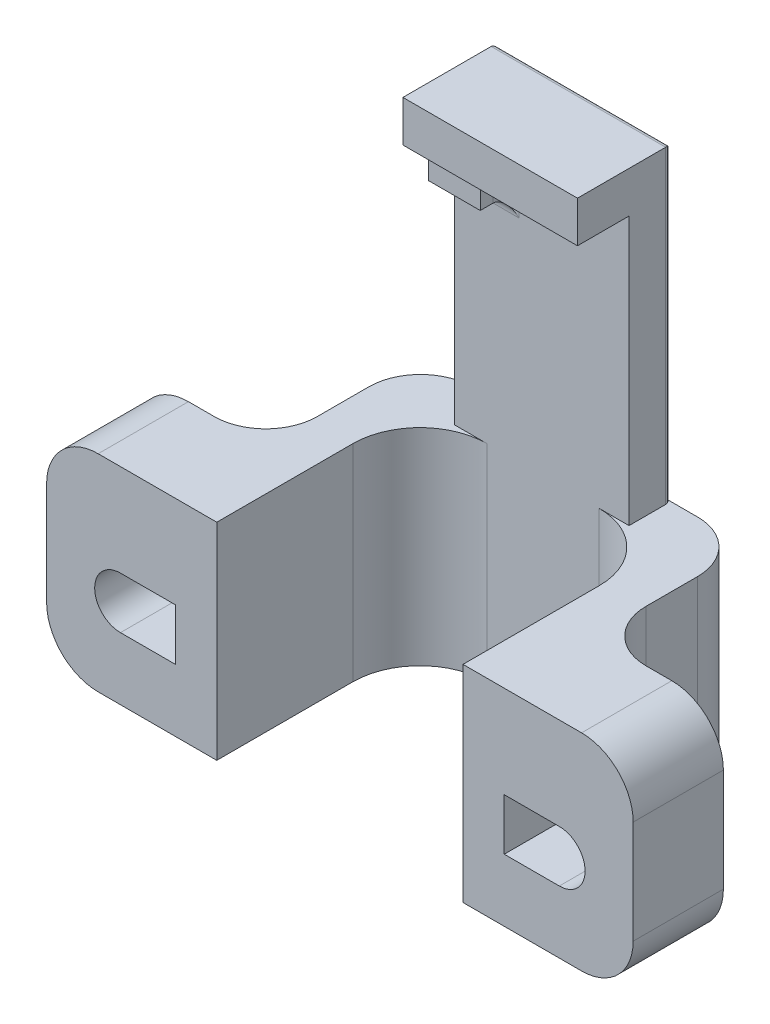
from build123d import *

# Parameters (mm, degrees)
BOSS_EXTRUDE1_DEPTH = 2.0574
SKETCH4_W           = 12.065
SKETCH4_H           = 10.16
BOSS_EXTRUDE2_DEPTH = 2.032
SKETCH5_W           = 12.065
SKETCH5_H           = 10.16
BOSS_EXTRUDE3_DEPTH = 2.032
SKETCH8_W           = 8.5979
SKETCH8_H           = 2.032
BOSS_EXTRUDE4_DEPTH = 2.54
FILLET22_R          = 3.302
CUT_EXTRUDE12_DEPTH = 13.208
SKETCH28_W          = 2.54
SKETCH28_H          = 1.27
BOSS_EXTRUDE6_DEPTH = 1.27
BOSS_EXTRUDE7_DEPTH = 4.445
FILLET23_R          = 0.635
CUT_EXTRUDE15_DEPTH = 1.651
FILLET25_R          = 0.254
FILLET26_R          = 2.54


with BuildPart() as part:
    # Sketch1 → Boss-Extrude1 (new body)
    with BuildSketch(Plane.XY):
        Polygon((0, 0), (12.1285, 0), (12.1285, 10.16), (10.2997, 10.16), (10.2997, 25.4), (1.7018, 25.4), (1.7018, 10.16), (0, 10.16), align=None)
    extrude(amount=BOSS_EXTRUDE1_DEPTH)

    # Sketch4 → Boss-Extrude2 (add)
    with BuildSketch(Plane(origin=(12.1285, 0, 0), x_dir=(0, 0, -1), z_dir=(1, 0, 0))):
        with Locations((-6.0325, 5.08)):
            Rectangle(SKETCH4_W, SKETCH4_H)
    extrude(amount=BOSS_EXTRUDE2_DEPTH)

    # Sketch5 → Boss-Extrude3 (add)
    with BuildSketch(Plane.ZY):
        with Locations((6.0325, 5.08)):
            Rectangle(SKETCH5_W, SKETCH5_H)
    extrude(amount=BOSS_EXTRUDE3_DEPTH)

    # Sketch8 → Boss-Extrude4 (add)
    with BuildSketch(Plane.XY.offset(2.0574)):
        with Locations((6.00075, 24.384)):
            Rectangle(SKETCH8_W, SKETCH8_H)
    extrude(amount=BOSS_EXTRUDE4_DEPTH)

    # Fillet22
    fillet22_edges = [part.edges().sort_by_distance(p)[0] for p in [
        (12.1285, 5.08, 2.0574),
        (0, 5.08, 2.0574),
    ]]
    fillet(fillet22_edges, radius=FILLET22_R)

    # Sketch26 → Cut-Extrude12 (cut)
    with BuildSketch(Plane.XZ.offset(-23.368)):
        Polygon((8.382, 4.5974), (1.7018, 4.5974), (1.620324679, 2.0574), (10.2997, 2.0574), (10.2997, 4.5974), align=None)
    extrude(amount=CUT_EXTRUDE12_DEPTH, mode=Mode.SUBTRACT)

    # Sketch28 → Boss-Extrude6 (add)
    with BuildSketch(Plane.XY.offset(2.0574)):
        with Locations((2.9718, 21.844)):
            Rectangle(SKETCH28_W, SKETCH28_H)
    extrude(amount=BOSS_EXTRUDE6_DEPTH)

    # Sketch30 → Boss-Extrude7 (add)
    with BuildSketch(Plane(origin=(0, 0, 12.065), x_dir=(-1, 0, 0), z_dir=(0, 0, -1))):
        with BuildLine():
            Line((2.032, 3.076559617), (2.032, 0))
            Line((2.032, 0), (5.842, 0))
            ThreePointArc((5.842, 0), (7.638051224, 0.743948776), (8.382, 2.54))
            Line((8.382, 2.54), (8.382, 7.62))
            ThreePointArc((8.382, 7.62), (7.638051224, 9.416051224), (5.842, 10.16))
            Line((5.842, 10.16), (2.032, 10.16))
            Line((2.032, 10.16), (2.032, 5.616559617))
            Line((2.032, 5.616559617), (4.744929833, 5.616559617))
            ThreePointArc((4.744929833, 5.616559617), (6.014929833, 4.346559617), (4.744929833, 3.076559617))
            Line((4.744929833, 3.076559617), (2.032, 3.076559617))
        make_face()
    boss_extrude7 = extrude(amount=BOSS_EXTRUDE7_DEPTH)

    # Fillet23
    fillet23_edges = [part.edges().sort_by_distance(p)[0] for p in [
        (2.9718, 21.209, 2.0574),
        (4.2418, 21.844, 2.0574),
    ]]
    fillet(fillet23_edges, radius=FILLET23_R)

    # Sketch34 → Cut-Extrude15 (cut)
    with BuildSketch(Plane(origin=(0, 0, 7.62), x_dir=(-1, 0, 0), z_dir=(0, 0, -1))):
        Polygon((4.744929833, 7.077059617), (2.380247468, 5.711809617), (2.380247468, 2.981309617), (4.744929833, 1.616059617), (7.109612198, 2.981309617), (7.109612198, 5.711809617), align=None)
    cut_extrude15 = extrude(amount=-CUT_EXTRUDE15_DEPTH, mode=Mode.SUBTRACT)

    # Fillet25
    fillet25_edges = [part.edges().sort_by_distance(p)[0] for p in [
        (1.7018, 17.78, 0),
        (6.00075, 25.4, 0),
        (10.2997, 17.78, 0),
    ]]
    fillet(fillet25_edges, radius=FILLET25_R)

    # Mirror7: Boss-Extrude7, Cut-Extrude15 across plane
    add(boss_extrude7.mirror(Plane(origin=(6.06425, 0, 0), x_dir=(0, 0, 1), z_dir=(1, 0, 0))))
    add(cut_extrude15.mirror(Plane(origin=(6.06425, 0, 0), x_dir=(0, 0, 1), z_dir=(1, 0, 0))), mode=Mode.SUBTRACT)

    # Fillet26
    # the kernel refuses this fillet: 2.54 mm, written as the material it adds along each edge
    with BuildSketch(Plane(origin=(-2.032, 9.426559617, 7.62), x_dir=(-1, 0, 0), z_dir=(0, -1, 0))) as fillet26_piece_1_section:
        with BuildLine():
            CenterArc((FILLET26_R, FILLET26_R), FILLET26_R, 180, 90)
            Line((0, FILLET26_R), (0, 0))
            Line((0, 0), (FILLET26_R, 0))
        make_face()
    fillet26_piece_1 = extrude(amount=15.776559617, mode=Mode.PRIVATE)
    fillet26_piece_1 = split(fillet26_piece_1, bisect_by=Plane(origin=(-2.868298698, 5.616559617, 7.255726229), z_dir=(0, 1, 0)), keep=Keep.TOP, mode=Mode.PRIVATE)
    fillet26_piece_1 = split(fillet26_piece_1, bisect_by=Plane(origin=(-3.61155926, 6.422707812, 7.255726229), z_dir=(0.5000000000000006, 0.8660254037844384, 0)), keep=Keep.TOP, mode=Mode.PRIVATE)
    add(fillet26_piece_1)
    with BuildSketch(Plane(origin=(-2.032, 9.426559617, 7.62), x_dir=(-1, 0, 0), z_dir=(0, -1, 0))) as fillet26_piece_2_section:
        with BuildLine():
            CenterArc((FILLET26_R, FILLET26_R), FILLET26_R, 180, 90)
            Line((0, FILLET26_R), (0, 0))
            Line((0, 0), (FILLET26_R, 0))
        make_face()
    fillet26_piece_2 = extrude(amount=15.776559617, mode=Mode.PRIVATE)
    fillet26_piece_2 = split(fillet26_piece_2, bisect_by=Plane(origin=(-2.323081937, 5.616559617, 6.938732997), z_dir=(0, 1, 0)), keep=Keep.TOP, mode=Mode.PRIVATE)
    fillet26_piece_2 = split(fillet26_piece_2, bisect_by=Plane(origin=(-2.380247468, 5.647682341, 6.938732997), z_dir=(1, 0, 0)), keep=Keep.TOP, mode=Mode.PRIVATE)
    add(fillet26_piece_2)
    with BuildSketch(Plane(origin=(-2.032, 3.076559617, 7.62), x_dir=(-1, 0, 0), z_dir=(0, -1, 0))) as fillet26_piece_3_section:
        with BuildLine():
            CenterArc((FILLET26_R, FILLET26_R), FILLET26_R, 180, 90)
            Line((0, FILLET26_R), (0, 0))
            Line((0, 0), (FILLET26_R, 0))
        make_face()
    fillet26_piece_3 = extrude(amount=3.076559617, mode=Mode.PRIVATE)
    fillet26_piece_3 = split(fillet26_piece_3, bisect_by=Plane(origin=(-2.380247468, 3.045436894, 6.938732997), z_dir=(1, 0, 0)), keep=Keep.TOP, mode=Mode.PRIVATE)
    add(fillet26_piece_3)
    with BuildSketch(Plane(origin=(-2.032, 9.426559617, 7.62), x_dir=(-1, 0, 0), z_dir=(0, -1, 0))) as fillet26_piece_4_section:
        with BuildLine():
            CenterArc((FILLET26_R, FILLET26_R), FILLET26_R, 180, 90)
            Line((0, FILLET26_R), (0, 0))
            Line((0, 0), (FILLET26_R, 0))
        make_face()
    fillet26_piece_4 = extrude(amount=9.426559617, mode=Mode.PRIVATE)
    fillet26_piece_4 = split(fillet26_piece_4, bisect_by=Plane(origin=(-2.380247468, 1.352070174, 7.252623905), z_dir=(-1, 0, 0)), keep=Keep.TOP, mode=Mode.PRIVATE)
    fillet26_piece_4 = split(fillet26_piece_4, bisect_by=Plane(origin=(-3.445782292, 2.3661228, 7.252623905), z_dir=(0.5000000000000002, -0.8660254037844386, 0)), keep=Keep.TOP, mode=Mode.PRIVATE)
    add(fillet26_piece_4)
    with BuildSketch(Plane(origin=(-2.032, 10.16, 7.62), x_dir=(-1, 0, 0), z_dir=(0, -1, 0))) as fillet26_piece_5_section:
        with BuildLine():
            CenterArc((FILLET26_R, FILLET26_R), FILLET26_R, 180, 90)
            Line((0, FILLET26_R), (0, 0))
            Line((0, 0), (FILLET26_R, 0))
        make_face()
    fillet26_piece_5 = extrude(amount=4.543440383, mode=Mode.PRIVATE)
    fillet26_piece_5 = split(fillet26_piece_5, bisect_by=Plane(origin=(-3.774867909, 6.516994104, 7.257731874), z_dir=(0.5000000000000006, 0.8660254037844384, 0)), keep=Keep.TOP, mode=Mode.PRIVATE)
    add(fillet26_piece_5)
    with BuildSketch(Plane(origin=(-2.032, 16.51, 7.62), x_dir=(-1, 0, 0), z_dir=(0, -1, 0))) as fillet26_piece_6_section:
        with BuildLine():
            CenterArc((FILLET26_R, FILLET26_R), FILLET26_R, 180, 90)
            Line((0, FILLET26_R), (0, 0))
            Line((0, 0), (FILLET26_R, 0))
        make_face()
    fillet26_piece_6 = extrude(amount=10.893440383, mode=Mode.PRIVATE)
    fillet26_piece_6 = split(fillet26_piece_6, bisect_by=Plane(origin=(-2.380247468, 5.647682341, 6.938732997), z_dir=(1, 0, 0)), keep=Keep.TOP, mode=Mode.PRIVATE)
    fillet26_piece_6 = split(fillet26_piece_6, bisect_by=Plane(origin=(-2.309605395, 5.671024397, 6.938732997), z_dir=(-0.5000000000000006, -0.8660254037844384, 0)), keep=Keep.TOP, mode=Mode.PRIVATE)
    add(fillet26_piece_6)
    with BuildSketch(Plane(origin=(-2.032, 16.51, 7.62), x_dir=(-1, 0, 0), z_dir=(0, -1, 0))) as fillet26_piece_7_section:
        with BuildLine():
            CenterArc((FILLET26_R, FILLET26_R), FILLET26_R, 180, 90)
            Line((0, FILLET26_R), (0, 0))
            Line((0, 0), (FILLET26_R, 0))
        make_face()
    fillet26_piece_7 = extrude(amount=17.243440383, mode=Mode.PRIVATE)
    fillet26_piece_7 = split(fillet26_piece_7, bisect_by=Plane(origin=(-2.323081937, 0, 6.938732997), z_dir=(0, 1, 0)), keep=Keep.TOP, mode=Mode.PRIVATE)
    fillet26_piece_7 = split(fillet26_piece_7, bisect_by=Plane(origin=(-2.323081937, 3.076559617, 6.938732997), z_dir=(0, -1, 0)), keep=Keep.TOP, mode=Mode.PRIVATE)
    fillet26_piece_7 = split(fillet26_piece_7, bisect_by=Plane(origin=(-2.380247468, 3.045436894, 6.938732997), z_dir=(1, 0, 0)), keep=Keep.TOP, mode=Mode.PRIVATE)
    add(fillet26_piece_7)
    with BuildSketch(Plane(origin=(-2.032, 16.51, 7.62), x_dir=(-1, 0, 0), z_dir=(0, -1, 0))) as fillet26_piece_8_section:
        with BuildLine():
            CenterArc((FILLET26_R, FILLET26_R), FILLET26_R, 180, 90)
            Line((0, FILLET26_R), (0, 0))
            Line((0, 0), (FILLET26_R, 0))
        make_face()
    fillet26_piece_8 = extrude(amount=17.243440383, mode=Mode.PRIVATE)
    fillet26_piece_8 = split(fillet26_piece_8, bisect_by=Plane(origin=(-2.860318736, 0, 7.252623905), z_dir=(0, 1, 0)), keep=Keep.TOP, mode=Mode.PRIVATE)
    fillet26_piece_8 = split(fillet26_piece_8, bisect_by=Plane(origin=(-2.380247468, 1.352070174, 7.252623905), z_dir=(-1, 0, 0)), keep=Keep.TOP, mode=Mode.PRIVATE)
    fillet26_piece_8 = split(fillet26_piece_8, bisect_by=Plane(origin=(-3.445782292, 2.3661228, 7.252623905), z_dir=(0.5000000000000002, -0.8660254037844386, 0)), keep=Keep.TOP, mode=Mode.PRIVATE)
    add(fillet26_piece_8)
    with BuildSketch(Plane(origin=(14.1605, 9.426559617, 7.62), x_dir=(0, 0, -1), z_dir=(0, -1, 0))) as fillet26_piece_9_section:
        with BuildLine():
            CenterArc((FILLET26_R, FILLET26_R), FILLET26_R, 180, 90)
            Line((0, FILLET26_R), (0, 0))
            Line((0, 0), (FILLET26_R, 0))
        make_face()
    fillet26_piece_9 = extrude(amount=15.776559617, mode=Mode.PRIVATE)
    fillet26_piece_9 = split(fillet26_piece_9, bisect_by=Plane(origin=(14.316328874, 5.616559617, 6.756250479), z_dir=(0, 1, 0)), keep=Keep.TOP, mode=Mode.PRIVATE)
    fillet26_piece_9 = split(fillet26_piece_9, bisect_by=Plane(origin=(14.508747468, 7.530619089, 6.756250479), z_dir=(-1, 0, 0)), keep=Keep.TOP, mode=Mode.PRIVATE)
    add(fillet26_piece_9)
    with BuildSketch(Plane(origin=(14.1605, 9.426559617, 7.62), x_dir=(0, 0, -1), z_dir=(0, -1, 0))) as fillet26_piece_10_section:
        with BuildLine():
            CenterArc((FILLET26_R, FILLET26_R), FILLET26_R, 180, 90)
            Line((0, FILLET26_R), (0, 0))
            Line((0, 0), (FILLET26_R, 0))
        make_face()
    fillet26_piece_10 = extrude(amount=15.776559617, mode=Mode.PRIVATE)
    fillet26_piece_10 = split(fillet26_piece_10, bisect_by=Plane(origin=(14.508747468, 7.710072871, 7.255726229), z_dir=(1, 0, 0)), keep=Keep.TOP, mode=Mode.PRIVATE)
    fillet26_piece_10 = split(fillet26_piece_10, bisect_by=Plane(origin=(15.740059261, 6.422707812, 7.255726229), z_dir=(-0.5000000000000006, 0.8660254037844384, 0)), keep=Keep.TOP, mode=Mode.PRIVATE)
    add(fillet26_piece_10)
    with BuildSketch(Plane(origin=(14.1605, 3.076559617, 7.62), x_dir=(0, 0, -1), z_dir=(0, -1, 0))) as fillet26_piece_11_section:
        with BuildLine():
            CenterArc((FILLET26_R, FILLET26_R), FILLET26_R, 180, 90)
            Line((0, FILLET26_R), (0, 0))
            Line((0, 0), (FILLET26_R, 0))
        make_face()
    fillet26_piece_11 = extrude(amount=3.076559617, mode=Mode.PRIVATE)
    fillet26_piece_11 = split(fillet26_piece_11, bisect_by=Plane(origin=(14.508747468, 3.04543688, 6.938733061), z_dir=(-1, 0, 0)), keep=Keep.TOP, mode=Mode.PRIVATE)
    add(fillet26_piece_11)
    with BuildSketch(Plane(origin=(14.1605, 9.426559617, 7.62), x_dir=(0, 0, -1), z_dir=(0, -1, 0))) as fillet26_piece_12_section:
        with BuildLine():
            CenterArc((FILLET26_R, FILLET26_R), FILLET26_R, 180, 90)
            Line((0, FILLET26_R), (0, 0))
            Line((0, 0), (FILLET26_R, 0))
        make_face()
    fillet26_piece_12 = extrude(amount=9.426559617, mode=Mode.PRIVATE)
    fillet26_piece_12 = split(fillet26_piece_12, bisect_by=Plane(origin=(14.508747468, 1.352070172, 7.252623905), z_dir=(1, 0, 0)), keep=Keep.TOP, mode=Mode.PRIVATE)
    fillet26_piece_12 = split(fillet26_piece_12, bisect_by=Plane(origin=(15.574282292, 2.3661228, 7.252623905), z_dir=(-0.5000000000000002, -0.8660254037844386, 0)), keep=Keep.TOP, mode=Mode.PRIVATE)
    add(fillet26_piece_12)
    with BuildSketch(Plane(origin=(14.1605, 10.16, 7.62), x_dir=(0, 0, -1), z_dir=(0, -1, 0))) as fillet26_piece_13_section:
        with BuildLine():
            CenterArc((FILLET26_R, FILLET26_R), FILLET26_R, 180, 90)
            Line((0, FILLET26_R), (0, 0))
            Line((0, 0), (FILLET26_R, 0))
        make_face()
    fillet26_piece_13 = extrude(amount=4.543440383, mode=Mode.PRIVATE)
    fillet26_piece_13 = split(fillet26_piece_13, bisect_by=Plane(origin=(14.508747468, 7.897356486, 6.756392786), z_dir=(-1, 0, 0)), keep=Keep.TOP, mode=Mode.PRIVATE)
    add(fillet26_piece_13)
    with BuildSketch(Plane(origin=(14.1605, 10.16, 7.62), x_dir=(0, 0, -1), z_dir=(0, -1, 0))) as fillet26_piece_14_section:
        with BuildLine():
            CenterArc((FILLET26_R, FILLET26_R), FILLET26_R, 180, 90)
            Line((0, FILLET26_R), (0, 0))
            Line((0, 0), (FILLET26_R, 0))
        make_face()
    fillet26_piece_14 = extrude(amount=10.893440383, mode=Mode.PRIVATE)
    fillet26_piece_14 = split(fillet26_piece_14, bisect_by=Plane(origin=(14.508747468, 8.078282345, 7.257731874), z_dir=(1, 0, 0)), keep=Keep.TOP, mode=Mode.PRIVATE)
    fillet26_piece_14 = split(fillet26_piece_14, bisect_by=Plane(origin=(15.903367909, 6.516994104, 7.257731874), z_dir=(-0.5000000000000006, 0.8660254037844384, 0)), keep=Keep.TOP, mode=Mode.PRIVATE)
    add(fillet26_piece_14)
    with BuildSketch(Plane(origin=(14.1605, 16.51, 7.62), x_dir=(0, 0, -1), z_dir=(0, -1, 0))) as fillet26_piece_15_section:
        with BuildLine():
            CenterArc((FILLET26_R, FILLET26_R), FILLET26_R, 180, 90)
            Line((0, FILLET26_R), (0, 0))
            Line((0, 0), (FILLET26_R, 0))
        make_face()
    fillet26_piece_15 = extrude(amount=17.243440383, mode=Mode.PRIVATE)
    fillet26_piece_15 = split(fillet26_piece_15, bisect_by=Plane(origin=(14.451581939, 0, 6.938733061), z_dir=(0, 1, 0)), keep=Keep.TOP, mode=Mode.PRIVATE)
    fillet26_piece_15 = split(fillet26_piece_15, bisect_by=Plane(origin=(14.451581939, 3.076559617, 6.938733061), z_dir=(0, -1, 0)), keep=Keep.TOP, mode=Mode.PRIVATE)
    fillet26_piece_15 = split(fillet26_piece_15, bisect_by=Plane(origin=(14.508747468, 3.04543688, 6.938733061), z_dir=(-1, 0, 0)), keep=Keep.TOP, mode=Mode.PRIVATE)
    add(fillet26_piece_15)
    with BuildSketch(Plane(origin=(14.1605, 16.51, 7.62), x_dir=(0, 0, -1), z_dir=(0, -1, 0))) as fillet26_piece_16_section:
        with BuildLine():
            CenterArc((FILLET26_R, FILLET26_R), FILLET26_R, 180, 90)
            Line((0, FILLET26_R), (0, 0))
            Line((0, 0), (FILLET26_R, 0))
        make_face()
    fillet26_piece_16 = extrude(amount=17.243440383, mode=Mode.PRIVATE)
    fillet26_piece_16 = split(fillet26_piece_16, bisect_by=Plane(origin=(14.988818735, 0, 7.252623905), z_dir=(0, 1, 0)), keep=Keep.TOP, mode=Mode.PRIVATE)
    fillet26_piece_16 = split(fillet26_piece_16, bisect_by=Plane(origin=(14.508747468, 1.352070172, 7.252623905), z_dir=(1, 0, 0)), keep=Keep.TOP, mode=Mode.PRIVATE)
    fillet26_piece_16 = split(fillet26_piece_16, bisect_by=Plane(origin=(15.574282292, 2.3661228, 7.252623905), z_dir=(-0.5000000000000002, -0.8660254037844386, 0)), keep=Keep.TOP, mode=Mode.PRIVATE)
    add(fillet26_piece_16)
    # the kernel refuses this fillet: 2.54 mm, written as the material it takes off along each edge
    with BuildSketch(Plane(origin=(-2.032, 16.51, 0), x_dir=(1, 0, 0), z_dir=(0, -1, 0))) as fillet26_2_piece_1:
        with BuildLine():
            CenterArc((FILLET26_R, FILLET26_R), FILLET26_R, 180, 90)
            Line((0, FILLET26_R), (0, 0))
            Line((0, 0), (FILLET26_R, 0))
        make_face()
    extrude(amount=22.86, mode=Mode.SUBTRACT)
    with BuildSketch(Plane(origin=(14.1605, 16.51, 0), x_dir=(-1, 0, 0), z_dir=(0, -1, 0))) as fillet26_2_piece_2:
        with BuildLine():
            CenterArc((FILLET26_R, -FILLET26_R), FILLET26_R, 90, 90)
            Line((0, -FILLET26_R), (0, 0))
            Line((0, 0), (FILLET26_R, 0))
        make_face()
    extrude(amount=22.86, mode=Mode.SUBTRACT)


solid = part.part
